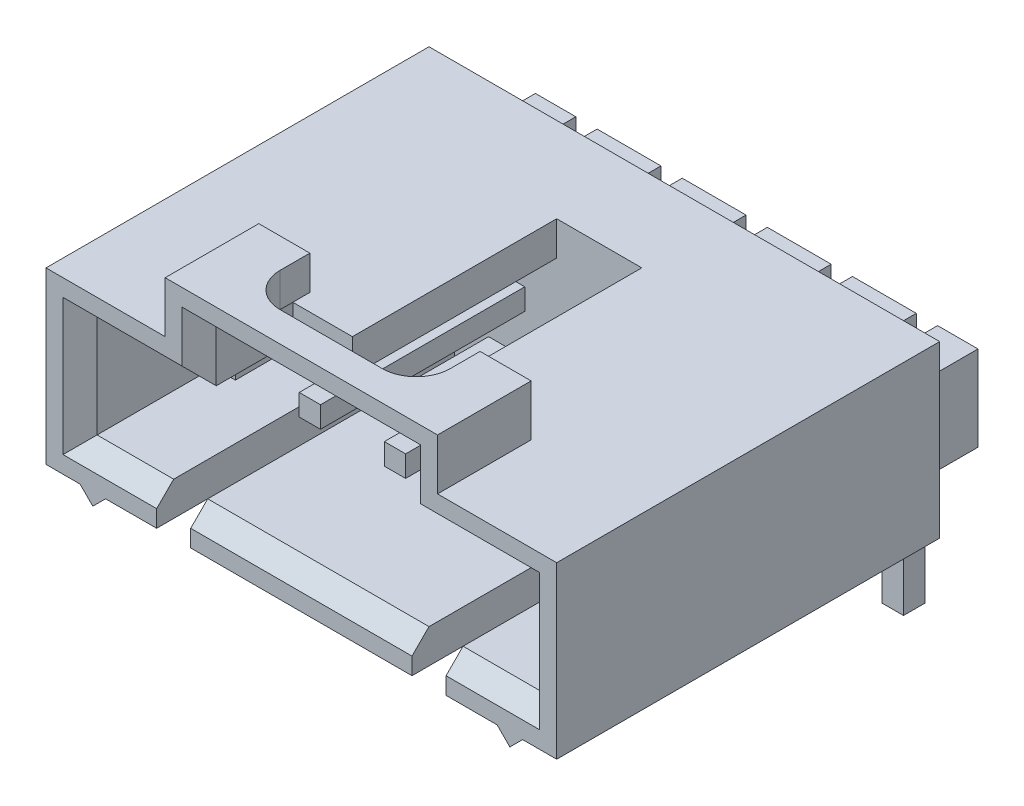
from build123d import *

# Parameters (mm, degrees)
SKETCH1_W            = 13.208
SKETCH1_H            = 3.556
BOSS_EXTRUDE1_DEPTH  = 0.762
SKETCH2_W            = 0.635
SKETCH2_H            = 0.662353677
BOSS_EXTRUDE2_DEPTH  = 1.016
SKETCH3_W            = 0.635
SKETCH3_H            = 0.662353677
BOSS_EXTRUDE3_DEPTH  = 1.016
SKETCH4_W            = 0.635
SKETCH4_H            = 0.662353677
BOSS_EXTRUDE4_DEPTH  = 1.016
SKETCH5_W            = 0.635
SKETCH5_H            = 0.662353677
BOSS_EXTRUDE5_DEPTH  = 1.016
SKETCH6_W            = 0.635
SKETCH6_H            = 0.662353677
BOSS_EXTRUDE6_DEPTH  = 1.016
SKETCH7_W            = 0.635
SKETCH7_H            = 0.635
BOSS_EXTRUDE7_DEPTH  = 5.839787113
SKETCH8_W            = 0.635
SKETCH8_H            = 0.635
BOSS_EXTRUDE8_DEPTH  = 5.839787113
SKETCH9_W            = 0.635
SKETCH9_H            = 0.635
BOSS_EXTRUDE9_DEPTH  = 5.839787113
SKETCH10_W           = 0.635
SKETCH10_H           = 0.635
BOSS_EXTRUDE10_DEPTH = 5.839787113
SKETCH11_W           = 0.635
SKETCH11_H           = 0.635
BOSS_EXTRUDE11_DEPTH = 5.839787113
BOSS_EXTRUDE12_DEPTH = 11.43
CUT_EXTRUDE1_REACH   = 15.26
SKETCH14_W           = 1.778
SKETCH14_H           = 1.016
CUT_EXTRUDE2_DEPTH   = 2.793999999
SKETCH15_W           = 1.778
SKETCH15_H           = 1.016
CUT_EXTRUDE3_DEPTH   = 2.794
BOSS_EXTRUDE13_DEPTH = 2.794
SKETCH17_W           = 6.604
SKETCH17_H           = 1.016
BOSS_EXTRUDE14_DEPTH = 8.89
SKETCH18_W           = 5.08
SKETCH18_H           = 1.016
CUT_EXTRUDE4_DEPTH   = 1.905
CHAMFER1_SIZE        = 0.508
CHAMFER2_SIZE        = 0.508
CHAMFER3_SIZE        = 0.508
DRAFT1_ANGLE         = 45
CHAMFER4_SIZE        = 0.508
SKETCH19_W           = 0.635
SKETCH19_H           = 0.635
BOSS_EXTRUDE15_DEPTH = 6.096
SKETCH20_W           = 0.635
SKETCH20_H           = 0.635
BOSS_EXTRUDE16_DEPTH = 6.096
SKETCH21_W           = 0.635
SKETCH21_H           = 0.635
BOSS_EXTRUDE17_DEPTH = 6.096
SKETCH22_W           = 0.635
SKETCH22_H           = 0.635
BOSS_EXTRUDE18_DEPTH = 6.096
SKETCH23_W           = 0.635
SKETCH23_H           = 0.635
BOSS_EXTRUDE19_DEPTH = 6.096
FILLET1_R            = 0.635
FILLET2_R            = 0.635
FILLET3_R            = 0.635
FILLET4_R            = 0.635
FILLET5_R            = 0.635
FILLET6_R            = 1.27
FILLET7_R            = 1.27
FILLET8_R            = 1.27
FILLET9_R            = 1.27
FILLET10_R           = 1.27
SKETCH24_W           = 1.905
SKETCH24_H           = 2.54
BOSS_EXTRUDE20_DEPTH = 1.397
SKETCH25_W           = 1.905
SKETCH25_H           = 2.54
BOSS_EXTRUDE21_DEPTH = 1.397
SKETCH26_W           = 1.905
SKETCH26_H           = 2.54
BOSS_EXTRUDE22_DEPTH = 1.397
SKETCH27_W           = 1.2065
SKETCH27_H           = 2.54
BOSS_EXTRUDE23_DEPTH = 1.397
SKETCH28_W           = 1.905
SKETCH28_H           = 2.54
BOSS_EXTRUDE24_DEPTH = 1.397
SKETCH29_W           = 1.2065
SKETCH29_H           = 2.54
BOSS_EXTRUDE25_DEPTH = 1.397
FILLET11_R           = 1.016
FILLET12_R           = 1.016


with BuildPart() as part:
    # Sketch1 → Boss-Extrude1 (new body)
    with BuildSketch(Plane(origin=(0, 0, -6.477), x_dir=(-1, 0, 0), z_dir=(0, 0, -1))):
        Rectangle(SKETCH1_W, SKETCH1_H)
    extrude(amount=-BOSS_EXTRUDE1_DEPTH)

    # Sketch2 → Boss-Extrude2 (add)
    with BuildSketch(Plane(origin=(0, 0, -6.477), x_dir=(-1, 0, 0), z_dir=(0, 0, -1))):
        with Locations((5.08, -0.052036048)):
            Rectangle(SKETCH2_W, SKETCH2_H)
    extrude(amount=BOSS_EXTRUDE2_DEPTH)

    # Sketch3 → Boss-Extrude3 (add)
    with BuildSketch(Plane(origin=(0, 0, -6.477), x_dir=(-1, 0, 0), z_dir=(0, 0, -1))):
        with Locations((2.54, -0.052036048)):
            Rectangle(SKETCH3_W, SKETCH3_H)
    extrude(amount=BOSS_EXTRUDE3_DEPTH)

    # Sketch4 → Boss-Extrude4 (add)
    with BuildSketch(Plane(origin=(0, 0, -6.477), x_dir=(-1, 0, 0), z_dir=(0, 0, -1))):
        with Locations((0, -0.052036048)):
            Rectangle(SKETCH4_W, SKETCH4_H)
    extrude(amount=BOSS_EXTRUDE4_DEPTH)

    # Sketch5 → Boss-Extrude5 (add)
    with BuildSketch(Plane(origin=(0, 0, -6.477), x_dir=(-1, 0, 0), z_dir=(0, 0, -1))):
        with Locations((-2.54, -0.052036048)):
            Rectangle(SKETCH5_W, SKETCH5_H)
    extrude(amount=BOSS_EXTRUDE5_DEPTH)

    # Sketch6 → Boss-Extrude6 (add)
    with BuildSketch(Plane(origin=(0, 0, -6.477), x_dir=(-1, 0, 0), z_dir=(0, 0, -1))):
        with Locations((-5.08, -0.052036048)):
            Rectangle(SKETCH6_W, SKETCH6_H)
    extrude(amount=BOSS_EXTRUDE6_DEPTH)

    # Sketch7 → Boss-Extrude7 (add)
    with BuildSketch(Plane.XZ.offset(0.383212887)):
        with Locations((5.08, -7.1755)):
            Rectangle(SKETCH7_W, SKETCH7_H)
    extrude(amount=BOSS_EXTRUDE7_DEPTH)

    # Sketch8 → Boss-Extrude8 (add)
    with BuildSketch(Plane.XZ.offset(0.383212887)):
        with Locations((2.54, -7.1755)):
            Rectangle(SKETCH8_W, SKETCH8_H)
    extrude(amount=BOSS_EXTRUDE8_DEPTH)

    # Sketch9 → Boss-Extrude9 (add)
    with BuildSketch(Plane.XZ.offset(0.383212887)):
        with Locations((0, -7.1755)):
            Rectangle(SKETCH9_W, SKETCH9_H)
    extrude(amount=BOSS_EXTRUDE9_DEPTH)

    # Sketch10 → Boss-Extrude10 (add)
    with BuildSketch(Plane.XZ.offset(0.383212887)):
        with Locations((-2.54, -7.1755)):
            Rectangle(SKETCH10_W, SKETCH10_H)
    extrude(amount=BOSS_EXTRUDE10_DEPTH)

    # Sketch11 → Boss-Extrude11 (add)
    with BuildSketch(Plane.XZ.offset(0.383212887)):
        with Locations((-5.08, -7.1755)):
            Rectangle(SKETCH11_W, SKETCH11_H)
    extrude(amount=BOSS_EXTRUDE11_DEPTH)

    # Sketch12 → Boss-Extrude12 (add)
    with BuildSketch(Plane(origin=(0, 0, -5.715), x_dir=(-1, 0, 0), z_dir=(0, 0, -1))):
        Polygon((7.62, 2.54), (-7.62, 2.54), (-7.62, -2.54), (-6.604, -2.54), (-5.842, -3.302), (-5.842, -2.54), (5.842, -2.54), (5.842, -3.302), (6.604, -2.54), (7.62, -2.54), align=None)
    extrude(amount=-BOSS_EXTRUDE12_DEPTH)

    # Sketch13 → Cut-Extrude1 (cut, up to next)
    with BuildSketch(Plane(origin=(0, 0, -3.175), x_dir=(-1, 0, 0), z_dir=(0, 0, -1)), mode=Mode.PRIVATE) as cut_extrude1_sk1:
        Polygon((-4.318, -2.54), (4.318, -2.54), (4.318, -1.524), (6.604, -1.524), (6.604, 1.524), (1.27, 1.524), (1.27, 2.54), (-1.27, 2.54), (-1.27, 1.524), (-6.604, 1.524), (-6.604, -1.524), (-4.318, -1.524), align=None)
    cut_extrude1_tool1 = extrude(cut_extrude1_sk1.sketch, amount=-CUT_EXTRUDE1_REACH, mode=Mode.PRIVATE) & part.part
    add(cut_extrude1_tool1.solids().sort_by_distance((0, -0.24384, -3.175))[0], mode=Mode.SUBTRACT)

    # Sketch14 → Cut-Extrude2 (cut)
    with BuildSketch(Plane.XY.offset(5.715)):
        with Locations((2.159, 2.032)):
            Rectangle(SKETCH14_W, SKETCH14_H)
    extrude(amount=-CUT_EXTRUDE2_DEPTH, mode=Mode.SUBTRACT)

    # Sketch15 → Cut-Extrude3 (cut)
    with BuildSketch(Plane.XY.offset(5.715)):
        with Locations((-2.159, 2.032)):
            Rectangle(SKETCH15_W, SKETCH15_H)
    extrude(amount=-CUT_EXTRUDE3_DEPTH, mode=Mode.SUBTRACT)

    # Sketch16 → Boss-Extrude13 (add)
    with BuildSketch(Plane.XY.offset(5.715)):
        Polygon((-3.048, 3.048), (3.048, 3.048), (3.048, 2.54), (4.064, 2.54), (4.064, 4.064), (-4.064, 4.064), (-4.064, 2.54), (-3.048, 2.54), align=None)
    extrude(amount=-BOSS_EXTRUDE13_DEPTH)

    # Sketch17 → Boss-Extrude14 (add)
    with BuildSketch(Plane.XY.offset(-3.175)):
        with Locations((0, -2.032)):
            Rectangle(SKETCH17_W, SKETCH17_H)
    extrude(amount=BOSS_EXTRUDE14_DEPTH)

    # Sketch18 → Cut-Extrude4 (cut)
    with BuildSketch(Plane(origin=(0, 0, 2.921), x_dir=(-1, 0, 0), z_dir=(0, 0, -1))):
        with Locations((0, 3.556)):
            Rectangle(SKETCH18_W, SKETCH18_H)
    extrude(amount=-CUT_EXTRUDE4_DEPTH, mode=Mode.SUBTRACT)

    # Chamfer1
    chamfer1_edges = [part.edges().sort_by_distance(p)[0] for p in [
        (2.159, 1.524, 2.921000001),
    ]]
    chamfer(chamfer1_edges, length=CHAMFER1_SIZE)

    # Chamfer2
    chamfer2_edges = [part.edges().sort_by_distance(p)[0] for p in [
        (-2.159, 1.524, 2.921),
    ]]
    chamfer(chamfer2_edges, length=CHAMFER2_SIZE)

    # Chamfer3
    chamfer3_edges = [part.edges().sort_by_distance(p)[0] for p in [
        (0, -1.524, 5.715),
    ]]
    chamfer(chamfer3_edges, length=CHAMFER3_SIZE)

    # Draft1
    draft1_faces = [part.faces().sort_by_distance(p)[0] for p in [
        (5.842, -2.921, 0),
        (-5.842, -2.921, 0),
    ]]
    draft(draft1_faces, Plane(origin=(5.842, -2.54, 5.715), x_dir=(0, 0, -1), z_dir=(0, -1, 0)), DRAFT1_ANGLE)

    # Chamfer4
    chamfer4_edges = [part.edges().sort_by_distance(p)[0] for p in [
        (5.461, -1.524, 5.715),
        (6.604, 0, 5.715),
        (4.826, 1.524, 5.715),
        (-6.604, 0, 5.715),
        (-5.461, -1.524, 5.715),
        (3.048, 2.032, 5.715),
        (-4.826, 1.524, 5.715),
        (-3.048, 2.032, 5.715),
        (0, 3.048, 5.715),
    ]]
    chamfer(chamfer4_edges, length=CHAMFER4_SIZE)

    # Sketch19 → Boss-Extrude15 (add)
    with BuildSketch(Plane.XY.offset(-3.175)):
        with Locations((5.08, -0.0127)):
            Rectangle(SKETCH19_W, SKETCH19_H)
    extrude(amount=BOSS_EXTRUDE15_DEPTH)

    # Sketch20 → Boss-Extrude16 (add)
    with BuildSketch(Plane.XY.offset(-3.175)):
        with Locations((2.54, -0.0127)):
            Rectangle(SKETCH20_W, SKETCH20_H)
    extrude(amount=BOSS_EXTRUDE16_DEPTH)

    # Sketch21 → Boss-Extrude17 (add)
    with BuildSketch(Plane.XY.offset(-3.175)):
        with Locations((0, -0.0127)):
            Rectangle(SKETCH21_W, SKETCH21_H)
    extrude(amount=BOSS_EXTRUDE17_DEPTH)

    # Sketch22 → Boss-Extrude18 (add)
    with BuildSketch(Plane.XY.offset(-3.175)):
        with Locations((-2.54, -0.0127)):
            Rectangle(SKETCH22_W, SKETCH22_H)
    extrude(amount=BOSS_EXTRUDE18_DEPTH)

    # Sketch23 → Boss-Extrude19 (add)
    with BuildSketch(Plane.XY.offset(2.921)):
        with Locations((-5.08, -0.0127)):
            Rectangle(SKETCH23_W, SKETCH23_H)
    extrude(amount=-BOSS_EXTRUDE19_DEPTH)

    # Fillet1
    # the kernel refuses this fillet: 0.635 mm, written as the material it adds along each edge
    with BuildSketch(Plane(origin=(-5.3975, -0.383212887, -6.858), x_dir=(0, 0, 1), z_dir=(1, 0, 0))) as fillet1_piece_1:
        with BuildLine():
            CenterArc((0.635, 0.581987113), FILLET1_R, 180, 66.421821522)
            Line((0, 0.581987113), (-0.0127, 0.581987113))
            Line((-0.0127, 0.581987113), (-0.0127, 0))
            Line((-0.0127, 0), (0, -0.0127))
            ThreePointArc((0, -0.0127), (0.1905, -0.0127), (0.37592, -0.011639742))
            Line((0.37592, -0.011639742), (0.381, 0))
        make_face()
    extrude(amount=0.635)

    # Fillet2
    # the kernel refuses this fillet: 0.635 mm, written as the material it adds along each edge
    with BuildSketch(Plane(origin=(-2.8575, -0.383212887, -6.858), x_dir=(0, 0, 1), z_dir=(1, 0, 0))) as fillet2_piece_1:
        with BuildLine():
            CenterArc((0.635, 0.581987113), FILLET2_R, 180, 66.421821522)
            Line((0, 0.581987113), (-0.0127, 0.581987113))
            Line((-0.0127, 0.581987113), (-0.0127, 0))
            Line((-0.0127, 0), (0, -0.0127))
            ThreePointArc((0, -0.0127), (0.1905, -0.0127), (0.37592, -0.011639742))
            Line((0.37592, -0.011639742), (0.381, 0))
        make_face()
    extrude(amount=0.635)

    # Fillet3
    # the kernel refuses this fillet: 0.635 mm, written as the material it adds along each edge
    with BuildSketch(Plane(origin=(-0.3175, -0.383212887, -6.858), x_dir=(0, 0, 1), z_dir=(1, 0, 0))) as fillet3_piece_1:
        with BuildLine():
            CenterArc((0.635, 0.581987113), FILLET3_R, 180, 66.421821522)
            Line((0, 0.581987113), (-0.0127, 0.581987113))
            Line((-0.0127, 0.581987113), (-0.0127, 0))
            Line((-0.0127, 0), (0, -0.0127))
            ThreePointArc((0, -0.0127), (0.1905, -0.0127), (0.37592, -0.011639742))
            Line((0.37592, -0.011639742), (0.381, 0))
        make_face()
    extrude(amount=0.635)

    # Fillet4
    # the kernel refuses this fillet: 0.635 mm, written as the material it adds along each edge
    with BuildSketch(Plane(origin=(2.2225, -0.383212887, -6.858), x_dir=(0, 0, 1), z_dir=(1, 0, 0))) as fillet4_piece_1:
        with BuildLine():
            CenterArc((0.635, 0.581987113), FILLET4_R, 180, 66.421821522)
            Line((0, 0.581987113), (-0.0127, 0.581987113))
            Line((-0.0127, 0.581987113), (-0.0127, 0))
            Line((-0.0127, 0), (0, -0.0127))
            ThreePointArc((0, -0.0127), (0.1905, -0.0127), (0.37592, -0.011639742))
            Line((0.37592, -0.011639742), (0.381, 0))
        make_face()
    extrude(amount=0.635)

    # Fillet5
    # the kernel refuses this fillet: 0.635 mm, written as the material it adds along each edge
    with BuildSketch(Plane(origin=(4.7625, -0.383212887, -6.858), x_dir=(0, 0, 1), z_dir=(1, 0, 0))) as fillet5_piece_1:
        with BuildLine():
            CenterArc((0.635, 0.581987113), FILLET5_R, 180, 66.421821522)
            Line((0, 0.581987113), (-0.0127, 0.581987113))
            Line((-0.0127, 0.581987113), (-0.0127, 0))
            Line((-0.0127, 0), (0, -0.0127))
            ThreePointArc((0, -0.0127), (0.1905, -0.0127), (0.37592, -0.011639742))
            Line((0.37592, -0.011639742), (0.381, 0))
        make_face()
    extrude(amount=0.635)

    # Fillet6
    # the kernel refuses this fillet: 1.27 mm, written as the material it takes off along each edge
    with BuildSketch(Plane(origin=(-4.7625, 0.27914079, -7.493), x_dir=(0, -1.5751835531463075e-12, 1.0), z_dir=(-1, 0, 0))) as fillet6_piece_1:
        with BuildLine():
            CenterArc((1.27, -1.244340789), FILLET6_R, 101.536959033, 78.463040967)
            Line((0, -1.244340789), (0, 0))
            Line((0, 0), (1.016, 0))
        make_face()
    extrude(amount=3.745851973, mode=Mode.SUBTRACT)

    # Fillet7
    # the kernel refuses this fillet: 1.27 mm, written as the material it takes off along each edge
    with BuildSketch(Plane(origin=(-2.2225, 0.27914079, -7.493), x_dir=(0, -1.5751835531463075e-12, 1.0), z_dir=(-1, 0, 0))) as fillet7_piece_1:
        with BuildLine():
            CenterArc((1.27, -1.244340789), FILLET7_R, 101.536959033, 78.463040967)
            Line((0, -1.244340789), (0, 0))
            Line((0, 0), (1.016, 0))
        make_face()
    extrude(amount=3.745851973, mode=Mode.SUBTRACT)

    # Fillet8
    # the kernel refuses this fillet: 1.27 mm, written as the material it takes off along each edge
    with BuildSketch(Plane(origin=(0.3175, 0.27914079, -7.493), x_dir=(0, -1.5751835531463075e-12, 1.0), z_dir=(-1, 0, 0))) as fillet8_piece_1:
        with BuildLine():
            CenterArc((1.27, -1.244340789), FILLET8_R, 101.536959033, 78.463040967)
            Line((0, -1.244340789), (0, 0))
            Line((0, 0), (1.016, 0))
        make_face()
    extrude(amount=3.745851974, mode=Mode.SUBTRACT)

    # Fillet9
    # the kernel refuses this fillet: 1.27 mm, written as the material it takes off along each edge
    with BuildSketch(Plane(origin=(2.8575, 0.27914079, -7.493), x_dir=(0, -1.5751835531463075e-12, 1.0), z_dir=(-1, 0, 0))) as fillet9_piece_1:
        with BuildLine():
            CenterArc((1.27, -1.244340789), FILLET9_R, 101.536959033, 78.463040967)
            Line((0, -1.244340789), (0, 0))
            Line((0, 0), (1.016, 0))
        make_face()
    extrude(amount=3.745851973, mode=Mode.SUBTRACT)

    # Fillet10
    # the kernel refuses this fillet: 1.27 mm, written as the material it takes off along each edge
    with BuildSketch(Plane(origin=(8.508351974, 0.27914079, -7.493), x_dir=(0, -1.5751835531463075e-12, 1.0), z_dir=(-1, 0, 0))) as fillet10_piece_1:
        with BuildLine():
            CenterArc((1.27, -1.244340789), FILLET10_R, 101.536959033, 78.463040967)
            Line((0, -1.244340789), (-0.0254, -1.244340789))
            Line((-0.0254, -1.244340789), (-0.0254, 0))
            Line((-0.0254, 0), (0, 0.0254))
            ThreePointArc((0, 0.0254), (0.508, 0.0254), (1.01092, 0.024886816))
            Line((1.01092, 0.024886816), (1.016, 0))
        make_face()
    extrude(amount=6.856703947, mode=Mode.SUBTRACT)

    # Sketch24 → Boss-Extrude20 (add)
    with BuildSketch(Plane(origin=(0, 0, -7.874), x_dir=(-1, 0, 0), z_dir=(0, 0, -1))):
        with Locations((1.27, -0.508)):
            Rectangle(SKETCH24_W, SKETCH24_H)
    extrude(amount=-BOSS_EXTRUDE20_DEPTH)

    # Sketch25 → Boss-Extrude21 (add)
    with BuildSketch(Plane(origin=(0, 0, -7.874), x_dir=(-1, 0, 0), z_dir=(0, 0, -1))):
        with Locations((-1.27, -0.508)):
            Rectangle(SKETCH25_W, SKETCH25_H)
    extrude(amount=-BOSS_EXTRUDE21_DEPTH)

    # Sketch26 → Boss-Extrude22 (add)
    with BuildSketch(Plane(origin=(0, 0, -7.874), x_dir=(-1, 0, 0), z_dir=(0, 0, -1))):
        with Locations((3.81, -0.508)):
            Rectangle(SKETCH26_W, SKETCH26_H)
    extrude(amount=-BOSS_EXTRUDE22_DEPTH)

    # Sketch27 → Boss-Extrude23 (add)
    with BuildSketch(Plane(origin=(0, 0, -7.874), x_dir=(-1, 0, 0), z_dir=(0, 0, -1))):
        with Locations((6.00075, -0.508)):
            Rectangle(SKETCH27_W, SKETCH27_H)
    extrude(amount=-BOSS_EXTRUDE23_DEPTH)

    # Sketch28 → Boss-Extrude24 (add)
    with BuildSketch(Plane(origin=(0, 0, -7.874), x_dir=(-1, 0, 0), z_dir=(0, 0, -1))):
        with Locations((-3.81, -0.508)):
            Rectangle(SKETCH28_W, SKETCH28_H)
    extrude(amount=-BOSS_EXTRUDE24_DEPTH)

    # Sketch29 → Boss-Extrude25 (add)
    with BuildSketch(Plane(origin=(0, 0, -7.874), x_dir=(-1, 0, 0), z_dir=(0, 0, -1))):
        with Locations((-6.00075, -0.508)):
            Rectangle(SKETCH29_W, SKETCH29_H)
    extrude(amount=-BOSS_EXTRUDE25_DEPTH)

    # Fillet11
    fillet11_edges = [part.edges().sort_by_distance(p)[0] for p in [
        (2.54, 3.556, 4.826),
    ]]
    fillet(fillet11_edges, radius=FILLET11_R)

    # Fillet12
    fillet12_edges = [part.edges().sort_by_distance(p)[0] for p in [
        (-2.54, 3.556, 4.826),
    ]]
    fillet(fillet12_edges, radius=FILLET12_R)


solid = part.part
